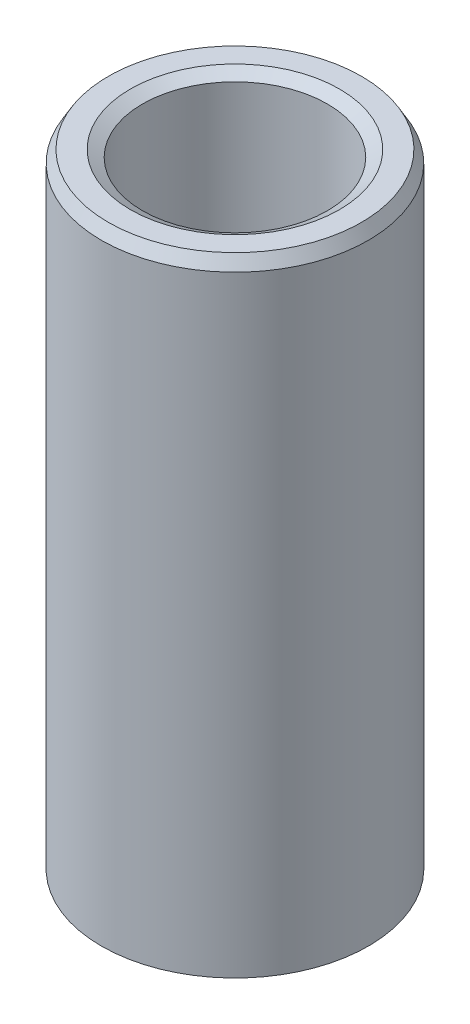
from build123d import *
from OCP.BRepFilletAPI import BRepFilletAPI_MakeChamfer

# Parameters (mm, degrees)
SKETCH1_R           = 15
BOSS_EXTRUDE1_DEPTH = 70.800274848
SKETCH2_R           = 10.391051658
CUT_EXTRUDE1_DEPTH  = 74.909937888
CHAMFER1_SIZE       = 1.352609088
CHAMFER1_SIZE2      = 0.780929221


with BuildPart() as part:
    # Sketch1 → Boss-Extrude1 (new body)
    with BuildSketch(Plane(origin=(0, 0, 0), x_dir=(1, 0, 0), z_dir=(0, 1, 0))):
        Circle(SKETCH1_R)
    extrude(amount=BOSS_EXTRUDE1_DEPTH)

    # Sketch2 → Cut-Extrude1 (cut, through all)
    with BuildSketch(Plane(origin=(0, 0, 0), x_dir=(1, 0, 0), z_dir=(0, 1, 0))):
        Circle(SKETCH2_R)
    extrude(amount=CUT_EXTRUDE1_DEPTH, mode=Mode.SUBTRACT)

    # Chamfer1: one chamfer whose edges measure the first distance from different faces: ONE call of the kernel's chamfer builder (chamfer() names one face for all edges)
    chamfer1_edges_1 = [part.edges().sort_by_distance(p)[0] for p in [
        (-10.391051658, 70.800274848, 0),
    ]]
    chamfer1_side_1 = [part.faces().sort_by_distance(p)[0] for p in [
        (-14.575735931, 70.800274848, 0),
    ]]
    chamfer1_edges_2 = [part.edges().sort_by_distance(p)[0] for p in [
        (-10.391051658, 0, 0),
    ]]
    chamfer1_side_2 = [part.faces().sort_by_distance(p)[0] for p in [
        (-10.391051658, 35.400137424, 0),
    ]]
    chamfer1_edges_3 = [part.edges().sort_by_distance(p)[0] for p in [
        (-15, 0, 0),
    ]]
    chamfer1_side_3 = [part.faces().sort_by_distance(p)[0] for p in [
        (-14.575735931, 0, 0),
    ]]
    chamfer1_edges_4 = [part.edges().sort_by_distance(p)[0] for p in [
        (-15, 70.800274848, 0),
    ]]
    chamfer1_side_4 = [part.faces().sort_by_distance(p)[0] for p in [
        (-15, 35.400137424, 0),
    ]]
    chamfer1 = BRepFilletAPI_MakeChamfer(part.part.solid().wrapped)
    for e in chamfer1_edges_1:
        chamfer1.Add(CHAMFER1_SIZE, CHAMFER1_SIZE2, e.wrapped, chamfer1_side_1[0].wrapped)  # the first distance lies on this face
    for e in chamfer1_edges_2:
        chamfer1.Add(CHAMFER1_SIZE, CHAMFER1_SIZE2, e.wrapped, chamfer1_side_2[0].wrapped)  # the first distance lies on this face
    for e in chamfer1_edges_3:
        chamfer1.Add(CHAMFER1_SIZE, CHAMFER1_SIZE2, e.wrapped, chamfer1_side_3[0].wrapped)  # the first distance lies on this face
    for e in chamfer1_edges_4:
        chamfer1.Add(CHAMFER1_SIZE, CHAMFER1_SIZE2, e.wrapped, chamfer1_side_4[0].wrapped)  # the first distance lies on this face
    add(Compound.cast(chamfer1.Shape()), mode=Mode.REPLACE)


solid = part.part
